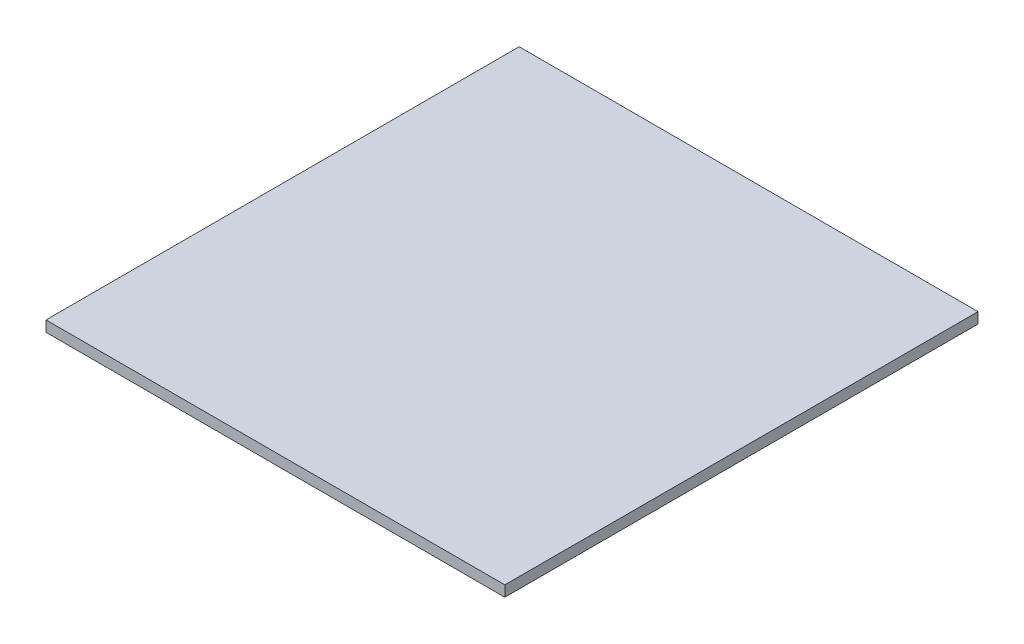
from build123d import *

# Parameters (mm, degrees)
SKETCH1_W           = 812.8
SKETCH1_H           = 838.2
BOSS_EXTRUDE1_DEPTH = 19.05


with BuildPart() as part:
    # Sketch1 → Boss-Extrude1 (new body)
    with BuildSketch(Plane(origin=(0, 0, 0), x_dir=(1, 0, 0), z_dir=(0, 1, 0))):
        with Locations((308.872119731, 340.598876734)):
            Rectangle(SKETCH1_W, SKETCH1_H)
    extrude(amount=BOSS_EXTRUDE1_DEPTH)


solid = part.part
